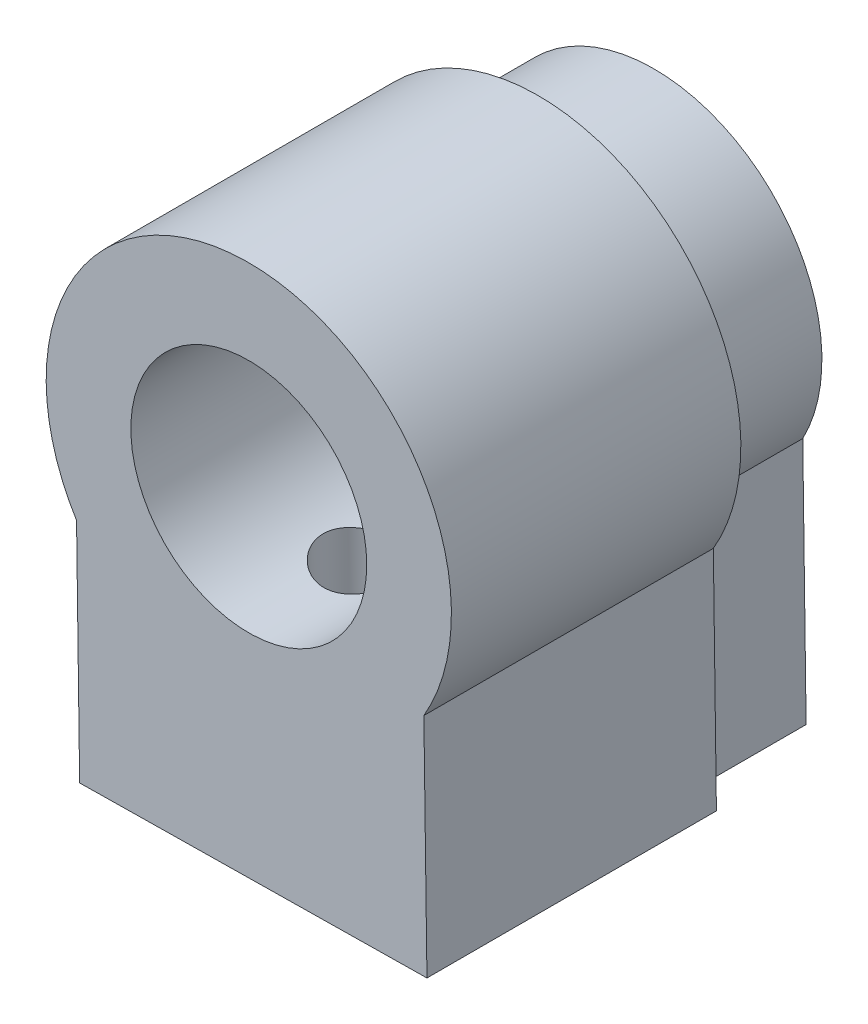
from build123d import *

# Parameters (mm, degrees)
BOSS_EXTRUDE1_DEPTH = 4
SKETCH2_R           = 4.075
BOSS_EXTRUDE3_DEPTH = 10
SKETCH6_R           = 1.35
CUT_EXTRUDE3_DEPTH  = 8.5


with BuildPart() as part:
    # Sketch1 → Boss-Extrude1 (new body)
    with BuildSketch(Plane.XY):
        with BuildLine():
            Line((-5.149547167, -4.77259565), (-5.033458211, -13.27259565))
            Line((-5.033458211, -13.27259565), (5.166541789, -13.133288902))
            Line((5.166541789, -13.133288902), (5.050452833, -4.633288902))
            ThreePointArc((5.050452833, -4.633288902), (-0.166463343, 3.857626495), (-5.149547167, -4.77259565))
        make_face()
    extrude(amount=BOSS_EXTRUDE1_DEPTH)

    # Sketch2 → Boss-Extrude3 (add)
    with BuildSketch(Plane.XY.offset(4)):
        with BuildLine():
            Line((6.067950407, -13.2651102), (5.961421717, -5.4651102))
            ThreePointArc((5.961421717, -5.4651102), (-0.182850844, 5.057514594), (-6.037459271, -5.628985208))
            Line((-6.037459271, -5.628985208), (-5.930930582, -13.428985208))
            Line((-5.930930582, -13.428985208), (6.067950407, -13.2651102))
        make_face()
        with Locations((-0.087257089, -1.94183265)):
            Circle(SKETCH2_R, mode=Mode.SUBTRACT)
    extrude(amount=BOSS_EXTRUDE3_DEPTH)

    # Sketch6 → Cut-Extrude3 (cut)
    with BuildSketch(Plane(origin=(0.182266409, -13.345494072, 0), x_dir=(-0.9999067490603969, -0.013656250710519674, 0), z_dir=(0.013656250710519674, -0.9999067490603969, 0))):
        with Locations((0.241163233, -10)):
            Circle(SKETCH6_R)
    extrude(amount=-CUT_EXTRUDE3_DEPTH, mode=Mode.SUBTRACT)


solid = part.part
